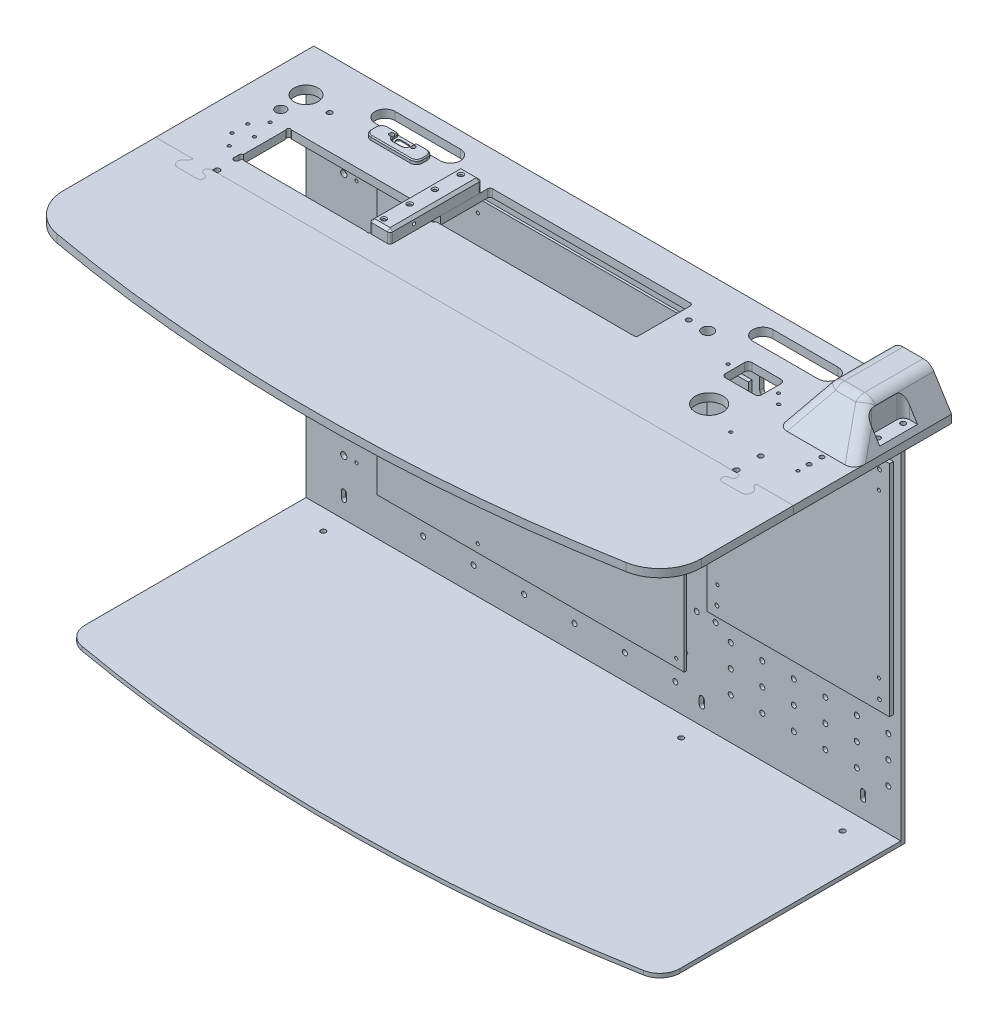
from build123d import *

# Parameters (mm, degrees)
BOSS_EXTRUDE1_DEPTH  = 6.35
SKETCH2_W            = 472
SKETCH2_H            = 287
BOSS_EXTRUDE2_DEPTH  = 3.2
CUT_EXTRUDE1_DEPTH   = 446.276139042
SKETCH4_W            = 243.84
SKETCH4_H            = 243.84
SKETCH4_R            = 1.25
BOSS_EXTRUDE3_DEPTH  = 1.9
SKETCH6_R            = 1.25
CUT_EXTRUDE3_DEPTH   = 446.276139042
SKETCH34_W           = 28
SKETCH34_H           = 87
CUT_EXTRUDE27_DEPTH  = 446.276139042
FILLET4_R            = 3
CUT_EXTRUDE2_DEPTH   = 403.651524274
SKETCH37_R           = 1.5
BOSS_EXTRUDE10_DEPTH = 3
CUT_EXTRUDE18_DEPTH  = 403.651524274
SKETCH36_W           = 41
SKETCH36_H           = 13.5
SKETCH36_R           = 1.75
BOSS_EXTRUDE9_DEPTH  = 3
CUT_EXTRUDE31_DEPTH  = 2.2
FILLET5_R            = 5
FILLET7_R            = 2
CHAMFER6_SIZE        = 0.8
SKETCH7_R            = 2
CUT_EXTRUDE4_DEPTH   = 403.651524274
SKETCH8_R            = 2
CUT_EXTRUDE5_DEPTH   = 446.276139042
SKETCH9_R            = 5.45
SKETCH9_R_2          = 9.525
SKETCH9_R_3          = 4
SKETCH9_R_4          = 4.5
CUT_EXTRUDE6_DEPTH   = 403.651524274
SKETCH10_R           = 1.25
SKETCH10_W           = 29
SKETCH10_H           = 21
CUT_EXTRUDE7_DEPTH   = 403.651524274
FILLET1_R            = 3
SKETCH11_R           = 11
CUT_EXTRUDE8_DEPTH   = 403.651524274
SKETCH13_R           = 1.25
CUT_EXTRUDE9_DEPTH   = 403.651524274
SKETCH14_R           = 1.5
CUT_EXTRUDE10_DEPTH  = 403.651524274
CUT_EXTRUDE15_DEPTH  = 403.651524274
SKETCH39_R           = 1.25
CUT_EXTRUDE29_DEPTH  = 408.202004538
SKETCH15_R           = 2
CUT_EXTRUDE11_DEPTH  = 446.276139042
SKETCH16_R           = 2
CUT_EXTRUDE12_DEPTH  = 403.651524274
SKETCH17_R           = 2
BOSS_EXTRUDE5_DEPTH  = 3.2
SKETCH18_R           = 1.25
SKETCH18_R_2         = 1.75
CUT_EXTRUDE13_DEPTH  = 403.651524274
BOSS_EXTRUDE6_DEPTH  = 6.35
CUT_EXTRUDE14_START  = -1
CUT_EXTRUDE14_DEPTH  = 8
SKETCH22_R           = 2.5
SKETCH22_R_2         = 1.25
CUT_EXTRUDE16_DEPTH  = 446.276139042
SKETCH26_W           = 60.9
SKETCH26_H           = 77.05
BOSS_EXTRUDE8_DEPTH  = 27
SKETCH27_W           = 21
SKETCH27_H           = 22
CUT_EXTRUDE20_DEPTH  = 25
CUT_EXTRUDE21_DEPTH  = 445.027727175
CUT_EXTRUDE23_DEPTH  = 596.109443716
CUT_EXTRUDE22_DEPTH  = 458.579501289
SKETCH31_R           = 5
SKETCH31_R_2         = 2
CUT_EXTRUDE24_DEPTH  = 408.202004538
CUT_EXTRUDE25_DEPTH  = 411.093004695
CHAMFER7_SIZE        = 2
FILLET8_R            = 10
SKETCH33_R           = 1.25
CUT_EXTRUDE26_DEPTH  = 408.2020046
CHAMFER2_SIZE        = 12
SKETCH38_R           = 1.25
CUT_EXTRUDE28_DEPTH  = 441.739651099
SKETCH40_W           = 16.42
SKETCH40_H           = 72.5
SKETCH40_R           = 1.35
BOSS_EXTRUDE11_DEPTH = 10
SKETCH42_R           = 1.25
CUT_EXTRUDE30_DEPTH  = 474.753761432
FILLET6_R            = 2
CHAMFER3_SIZE        = 2
CHAMFER4_SIZE        = 0.8
CHAMFER5_SIZE        = 1


with BuildPart() as part:
    # Sketch1 → Boss-Extrude1 (new body)
    with BuildSketch(Plane(origin=(0, 0, 0), x_dir=(1, 0, 0), z_dir=(0, 1, 0))):
        with BuildLine():
            Line((-253, 125.5), (253, 125.5))
            Line((253, 125.5), (253, -73.008828273))
            ThreePointArc((253, -73.008828273), (245.302764436, -94.193023133), (225.801811401, -105.494809626))
            ThreePointArc((225.801811401, -105.494809626), (0, -125.5), (-225.801811401, -105.494809626))
            ThreePointArc((-225.801811401, -105.494809626), (-245.302764436, -94.193023133), (-253, -73.008828273))
            Line((-253, -73.008828273), (-253, 125.5))
        make_face()
        with BuildLine():
            Line((175.75, 96.8), (124, 96.8))
            ThreePointArc((124, 96.8), (116, 104.8), (124, 112.8))
            Line((124, 112.8), (175.75, 112.8))
            ThreePointArc((175.75, 112.8), (183.75, 104.8), (175.75, 96.8))
        make_face(mode=Mode.SUBTRACT)
        with BuildLine():
            Line((-175.75, 112.8), (-124, 112.8))
            ThreePointArc((-124, 112.8), (-116, 104.8), (-124, 96.8))
            Line((-124, 96.8), (-175.75, 96.8))
            ThreePointArc((-175.75, 96.8), (-183.75, 104.8), (-175.75, 112.8))
        make_face(mode=Mode.SUBTRACT)
    extrude(amount=BOSS_EXTRUDE1_DEPTH)

    # Sketch5 → Cut-Extrude2 (cut, through all)
    with BuildSketch(Plane.XZ):
        with BuildLine():
            Line((75, -55.3), (75, -96.3))
            ThreePointArc((75, -96.3), (74.414213562, -97.714213562), (73, -98.3))
            Line((73, -98.3), (-84, -98.3))
            ThreePointArc((-84, -98.3), (-85.414213562, -97.714213562), (-86, -96.3))
            Line((-86, -96.3), (-86, -55.3))
            ThreePointArc((-86, -55.3), (-85.414213562, -53.885786438), (-84, -53.3))
            Line((-84, -53.3), (73, -53.3))
            ThreePointArc((73, -53.3), (74.414213562, -53.885786438), (75, -55.3))
        make_face()
    extrude(amount=-CUT_EXTRUDE2_DEPTH, mode=Mode.SUBTRACT)

    # USB-C-sketch → Cut-Extrude18 (cut, through all)
    with BuildSketch(Plane.XZ):
        with BuildLine():
            Line((-162.375, -96.8), (-137.375, -96.8))
            Line((-137.375, -96.8), (-137.375, -92.55))
            ThreePointArc((-137.375, -92.55), (-138.61979618, -89.54479618), (-141.625, -88.3))
            Line((-141.625, -88.3), (-158.125, -88.3))
            ThreePointArc((-158.125, -88.3), (-161.13020382, -89.54479618), (-162.375, -92.55))
            Line((-162.375, -92.55), (-162.375, -96.8))
        make_face()
    extrude(amount=-CUT_EXTRUDE18_DEPTH, mode=Mode.SUBTRACT)

    # Sketch7 → Cut-Extrude4 (cut, through all)
    with BuildSketch(Plane.XZ):
        with Locations(Location((84, -86, 0), (0, 0, 270))):
            Circle(SKETCH7_R)
        with Locations(Location((-201, -86, 0), (0, 0, 270))):
            Circle(SKETCH7_R)
        with Locations(Location((201, -86, 0), (0, 0, 270))):
            Circle(SKETCH7_R)
        with Locations(Location((-107, -86, 0), (0, 0, 270))):
            Circle(SKETCH7_R)
    extrude(amount=-CUT_EXTRUDE4_DEPTH, mode=Mode.SUBTRACT)

    # Sketch9 → Cut-Extrude6 (cut, through all)
    with BuildSketch(Plane.XZ):
        with Locations(Location((222.55, -88.85, 0), (0, 0, 270))):
            Circle(SKETCH9_R)
        with Locations(Location((-222.55, -88.85, 0), (0, 0, 270))):
            Circle(SKETCH9_R_2)
        with Locations(Location((-222.55, -68.85, 0), (0, 0, 270))):
            Circle(SKETCH9_R_3)
        with Locations(Location((99, -86, 0), (0, 0, 270))):
            Circle(SKETCH9_R_4)
    extrude(amount=-CUT_EXTRUDE6_DEPTH, mode=Mode.SUBTRACT)

    # Sketch10 → Cut-Extrude7 (cut, through all)
    with BuildSketch(Plane.XZ):
        with Locations(Location((129.875, -71.3, 0), (0, 0, 270))):
            Circle(SKETCH10_R)
        with Locations(Location((169.875, -71.3, 0), (0, 0, 270))):
            Circle(SKETCH10_R)
        with Locations((149.875, -71.3)):
            Rectangle(SKETCH10_W, SKETCH10_H)
    extrude(amount=-CUT_EXTRUDE7_DEPTH, mode=Mode.SUBTRACT)

    # Fillet1
    fillet1_edges = [part.edges().sort_by_distance(p)[0] for p in [
        (164.375, 3.175, -60.8),
        (164.375, 3.175, -81.8),
        (135.375, 3.175, -81.8),
        (135.375, 3.175, -60.8),
    ]]
    fillet(fillet1_edges, radius=FILLET1_R)

    # Sketch11 → Cut-Extrude8 (cut, through all)
    with BuildSketch(Plane.XZ):
        with Locations(Location((149.875, -36.3, 0), (0, 0, 270))):
            Circle(SKETCH11_R)
    extrude(amount=-CUT_EXTRUDE8_DEPTH, mode=Mode.SUBTRACT)

    # Sketch13 → Cut-Extrude9 (cut, through all)
    with BuildSketch(Plane.XZ):
        with Locations(Location((-214.183553391, -39.5, 0), (0, 0, 270))):
            Circle(SKETCH13_R)
        with Locations(Location((-217.933553391, -55.75, 0), (0, 0, 270))):
            Circle(SKETCH13_R)
        with Locations(Location((-225.67, -45.75, 0), (0, 0, 270))):
            Circle(SKETCH13_R)
        with Locations(Location((-225.67, -33.25, 0), (0, 0, 270))):
            Circle(SKETCH13_R)
        with Locations(Location((-217.933553391, -23.25, 0), (0, 0, 270))):
            Circle(SKETCH13_R)
        with Locations(Location((-96.42, -24.5, 0), (0, 0, 270))):
            Circle(SKETCH13_R)
        Polygon((-206.42, -59), (-103.42, -59), (-102.42, -59), (-102.42, -19), (-206.42, -19), (-206.42, -20), align=None)
    extrude(amount=-CUT_EXTRUDE9_DEPTH, mode=Mode.SUBTRACT)

    # Sketch14 → Cut-Extrude10 (cut, through all)
    with BuildSketch(Plane.XZ):
        with Locations((-205.359339828, -20.060660172)):
            Circle(SKETCH14_R)
        with Locations((-205.359339828, -57.939339828)):
            Circle(SKETCH14_R)
        with Locations((-103.480660172, -20.060660172)):
            Circle(SKETCH14_R)
        with BuildLine():
            Line((-102.42, -59), (-102.42, -64))
            ThreePointArc((-102.42, -64), (-104.92, -66.5), (-107.42, -64))
            Line((-107.42, -64), (-107.42, -59))
            Line((-107.42, -59), (-102.42, -59))
        make_face()
    extrude(amount=-CUT_EXTRUDE10_DEPTH, mode=Mode.SUBTRACT)

    # Sketch20 → Cut-Extrude15 (cut, through all)
    with BuildSketch(Plane.XZ):
        with BuildLine():
            Line((-102.42, -51), (-87.42, -51))
            ThreePointArc((-87.42, -51), (-84.591572875, -52.171572875), (-83.42, -55))
            Line((-83.42, -55), (-83.42, -59))
            Line((-83.42, -59), (-87.42, -59))
            Line((-87.42, -59), (-102.42, -59))
            Line((-102.42, -59), (-102.42, -51))
        make_face()
    extrude(amount=-CUT_EXTRUDE15_DEPTH, mode=Mode.SUBTRACT)

    # Sketch39 → Cut-Extrude29 (cut, through all)
    with BuildSketch(Plane(origin=(0, 6.35, 0), x_dir=(1, 0, 0), z_dir=(0, 1, 0))):
        with Locations(Location((-96.42, 45, 0), (0, 0, 270))):
            Circle(SKETCH39_R)
        with Locations(Location((-96.42, 65, 0), (0, 0, 270))):
            Circle(SKETCH39_R)
        with Locations(Location((-96.42, 85.5, 0), (0, 0, 270))):
            Circle(SKETCH39_R)
    extrude(amount=-CUT_EXTRUDE29_DEPTH, mode=Mode.SUBTRACT)

    # Sketch16 → Cut-Extrude12 (cut, through all)
    with BuildSketch(Plane.XZ):
        with Locations(Location((206, -21, 0), (0, 0, 270))):
            Circle(SKETCH16_R)
        with BuildLine():
            Line((-208, -2), (-208, 0))
            Line((-208, 0), (-204, 0))
            Line((-204, 0), (-204, -2))
            ThreePointArc((-204, -2), (-206, -4), (-208, -2))
        make_face()
        with BuildLine():
            Line((204, -2), (204, 0))
            Line((204, 0), (208, 0))
            Line((208, 0), (208, -2))
            ThreePointArc((208, -2), (206, -4), (204, -2))
        make_face()
        with BuildLine():
            Line((-208, -21), (-208, -17))
            ThreePointArc((-208, -17), (-206, -15), (-204, -17))
            Line((-204, -17), (-204, -21))
            ThreePointArc((-204, -21), (-206, -23), (-208, -21))
        make_face()
    extrude(amount=-CUT_EXTRUDE12_DEPTH, mode=Mode.SUBTRACT)


with BuildPart() as body_2:
    # Sketch2 → Boss-Extrude2 (new body)
    with BuildSketch(Plane(origin=(0, 0, -105.5), x_dir=(-1, 0, 0), z_dir=(0, 0, -1))):
        with Locations((0, -143.5)):
            Rectangle(SKETCH2_W, SKETCH2_H)
    extrude(amount=-BOSS_EXTRUDE2_DEPTH)

    # Sketch3 → Cut-Extrude1 (cut, through all)
    with BuildSketch(Plane.XY.offset(-102.3)):
        with BuildLine():
            Line((-172.75, -33), (-127, -33))
            ThreePointArc((-127, -33), (-124.878679656, -32.121320344), (-124, -30))
            Line((-124, -30), (-124, 0))
            Line((-124, 0), (-175.75, 0))
            Line((-175.75, 0), (-175.75, -30))
            ThreePointArc((-175.75, -30), (-174.871320344, -32.121320344), (-172.75, -33))
        make_face()
        with BuildLine():
            Line((124, -30), (124, 0))
            Line((124, 0), (175.75, 0))
            Line((175.75, 0), (175.75, -30))
            ThreePointArc((175.75, -30), (174.871320344, -32.121320344), (172.75, -33))
            Line((172.75, -33), (127, -33))
            ThreePointArc((127, -33), (124.878679656, -32.121320344), (124, -30))
        make_face()
    extrude(amount=-CUT_EXTRUDE1_DEPTH, mode=Mode.SUBTRACT)

    # Sketch6 → Cut-Extrude3 (cut, through all)
    with BuildSketch(Plane.XY.offset(-102.3)):
        with Locations(Location((-91.83, -239.49, 0), (0, 0, 180))):
            Circle(SKETCH6_R)
        with Locations(Location((-91.83, -167.1, 0), (0, 0, 180))):
            Circle(SKETCH6_R)
        with Locations(Location((-137.55, -167.1, 0), (0, 0, 180))):
            Circle(SKETCH6_R)
        with Locations(Location((-157.87, -167.1, 0), (0, 0, 180))):
            Circle(SKETCH6_R)
        with Locations(Location((65.65, -167.1, 0), (0, 0, 180))):
            Circle(SKETCH6_R)
        with Locations(Location((65.65, -239.49, 0), (0, 0, 180))):
            Circle(SKETCH6_R)
        with Locations(Location((65.65, -35.02, 0), (0, 0, 180))):
            Circle(SKETCH6_R)
        with Locations(Location((-137.55, -12.16, 0), (0, 0, 180))):
            Circle(SKETCH6_R)
        with Locations(Location((-91.83, -12.16, 0), (0, 0, 180))):
            Circle(SKETCH6_R)
        with Locations((99, -28)):
            Circle(SKETCH6_R)
        with Locations((228, -28)):
            Circle(SKETCH6_R)
        with Locations((228, -186)):
            Circle(SKETCH6_R)
        with Locations((99, -186)):
            Circle(SKETCH6_R)
    extrude(amount=-CUT_EXTRUDE3_DEPTH, mode=Mode.SUBTRACT)

    # Sketch34 → Cut-Extrude27 (cut, through all)
    with BuildSketch(Plane.XY.offset(-102.3)):
        with Locations((-65, -85.5)):
            Rectangle(SKETCH34_W, SKETCH34_H)
    extrude(amount=-CUT_EXTRUDE27_DEPTH, mode=Mode.SUBTRACT)

    # Fillet4
    fillet4_edges = [body_2.edges().sort_by_distance(p)[0] for p in [
        (-51, -42, -103.9),
        (-51, -129, -103.9),
        (-79, -129, -103.9),
        (-79, -42, -103.9),
    ]]
    fillet(fillet4_edges, radius=FILLET4_R)

    # Sketch8 → Cut-Extrude5 (cut, through all)
    with BuildSketch(Plane.XY.offset(-102.3)):
        with Locations((-201, -16.3)):
            Circle(SKETCH8_R)
        with Locations((84, -16.3)):
            Circle(SKETCH8_R)
        with Locations((201, -16.3)):
            Circle(SKETCH8_R)
        with Locations((-107, -16.3)):
            Circle(SKETCH8_R)
        with BuildLine():
            Line((-204, -265), (-204, -270))
            ThreePointArc((-204, -270), (-206, -272), (-208, -270))
            Line((-208, -270), (-208, -265))
            ThreePointArc((-208, -265), (-206, -263), (-204, -265))
        make_face()
        with BuildLine():
            Line((76, -270), (76, -265))
            ThreePointArc((76, -265), (78, -263), (80, -265))
            Line((80, -265), (80, -270))
            ThreePointArc((80, -270), (78, -272), (76, -270))
        make_face()
        with BuildLine():
            Line((204, -265), (204, -270))
            ThreePointArc((204, -270), (206, -272), (208, -270))
            Line((208, -270), (208, -265))
            ThreePointArc((208, -265), (206, -263), (204, -265))
        make_face()
    extrude(amount=-CUT_EXTRUDE5_DEPTH, mode=Mode.SUBTRACT)

    # Sketch15 → Cut-Extrude11 (cut, through all)
    with BuildSketch(Plane.XY.offset(-102.3)):
        with Locations((101, -197)):
            Circle(SKETCH15_R)
        with Locations((74, -85.02)):
            Circle(SKETCH15_R)
        with Locations((89, -85.02)):
            Circle(SKETCH15_R)
        with Locations((74, -167.1)):
            Circle(SKETCH15_R)
        with Locations((89, -167.1)):
            Circle(SKETCH15_R)
        with Locations((57, -248.84)):
            Circle(SKETCH15_R)
        with Locations((57, -263.84)):
            Circle(SKETCH15_R)
        with Locations((17, -248.84)):
            Circle(SKETCH15_R)
        with Locations((17, -263.84)):
            Circle(SKETCH15_R)
        with Locations((-23, -248.84)):
            Circle(SKETCH15_R)
        with Locations((-23, -263.84)):
            Circle(SKETCH15_R)
        with Locations((-63, -248.84)):
            Circle(SKETCH15_R)
        with Locations((-63, -263.84)):
            Circle(SKETCH15_R)
        with Locations((-103, -248.84)):
            Circle(SKETCH15_R)
        with Locations((-103, -263.84)):
            Circle(SKETCH15_R)
        with Locations((74, -207.1)):
            Circle(SKETCH15_R)
        with Locations((89, -207.1)):
            Circle(SKETCH15_R)
        with Locations((126, -197)):
            Circle(SKETCH15_R)
        with Locations((151, -197)):
            Circle(SKETCH15_R)
        with Locations((176, -197)):
            Circle(SKETCH15_R)
        with Locations((201, -197)):
            Circle(SKETCH15_R)
        with Locations((226, -197)):
            Circle(SKETCH15_R)
        with Locations((126, -215)):
            Circle(SKETCH15_R)
        with Locations((151, -215)):
            Circle(SKETCH15_R)
        with Locations((176, -215)):
            Circle(SKETCH15_R)
        with Locations((201, -215)):
            Circle(SKETCH15_R)
        with Locations((226, -215)):
            Circle(SKETCH15_R)
        with Locations((126, -233)):
            Circle(SKETCH15_R)
        with Locations((151, -233)):
            Circle(SKETCH15_R)
        with Locations((176, -233)):
            Circle(SKETCH15_R)
        with Locations((201, -233)):
            Circle(SKETCH15_R)
        with Locations((226, -233)):
            Circle(SKETCH15_R)
        with Locations((126, -251)):
            Circle(SKETCH15_R)
        with Locations((151, -251)):
            Circle(SKETCH15_R)
        with Locations((176, -251)):
            Circle(SKETCH15_R)
        with Locations((201, -251)):
            Circle(SKETCH15_R)
        with Locations((226, -251)):
            Circle(SKETCH15_R)
        with Locations((101, -215)):
            Circle(SKETCH15_R)
        with Locations((101, -233)):
            Circle(SKETCH15_R)
        with Locations((101, -251)):
            Circle(SKETCH15_R)
        with Locations((-103, -167.1)):
            Circle(SKETCH15_R)
        with Locations((-116.5, -167.1)):
            Circle(SKETCH15_R)
        with Locations((-103, -127.1)):
            Circle(SKETCH15_R)
        with Locations((-116.5, -127.1)):
            Circle(SKETCH15_R)
        with Locations((-103, -87.1)):
            Circle(SKETCH15_R)
        with Locations((-116.5, -87.1)):
            Circle(SKETCH15_R)
        with Locations((-103, -47.1)):
            Circle(SKETCH15_R)
        with Locations((-116.5, -47.1)):
            Circle(SKETCH15_R)
        with Locations((-143, -248.84)):
            Circle(SKETCH15_R)
        with Locations((-143, -263.84)):
            Circle(SKETCH15_R)
        with Locations((-130, -47.1)):
            Circle(SKETCH15_R)
        with Locations((-143.5, -47.1)):
            Circle(SKETCH15_R)
        with Locations((-143.5, -87.1)):
            Circle(SKETCH15_R)
        with Locations((-143.5, -127.1)):
            Circle(SKETCH15_R)
        with Locations((-130, -87.1)):
            Circle(SKETCH15_R)
        with Locations((-130, -127.1)):
            Circle(SKETCH15_R)
        with Locations((74, -28)):
            Circle(SKETCH15_R)
        with Locations((89, -28)):
            Circle(SKETCH15_R)
        with Locations((74, -126.06)):
            Circle(SKETCH15_R)
        with Locations((89, -126.06)):
            Circle(SKETCH15_R)
        with Locations((-157, -47.1)):
            Circle(SKETCH15_R)
        with Locations((-157, -87.1)):
            Circle(SKETCH15_R)
        with Locations((-157, -127.1)):
            Circle(SKETCH15_R)
    extrude(amount=-CUT_EXTRUDE11_DEPTH, mode=Mode.SUBTRACT)

    # Sketch22 → Cut-Extrude16 (cut, through all)
    with BuildSketch(Plane.XY.offset(-102.3)):
        with Locations((-206, -240)):
            Circle(SKETCH22_R)
        with Locations((-206, -201.26)):
            Circle(SKETCH22_R)
        with Locations((-206, -162.52)):
            Circle(SKETCH22_R)
        with Locations((-206, -123.78)):
            Circle(SKETCH22_R)
        with Locations((-206, -85.04)):
            Circle(SKETCH22_R)
        with Locations((-206, -46.3)):
            Circle(SKETCH22_R)
        with Locations((-196, -240)):
            Circle(SKETCH22_R_2)
        with Locations((-196, -201.26)):
            Circle(SKETCH22_R_2)
        with Locations((-196, -162.52)):
            Circle(SKETCH22_R_2)
        with Locations((-196, -123.78)):
            Circle(SKETCH22_R_2)
        with Locations((-196, -85.04)):
            Circle(SKETCH22_R_2)
        with Locations((-196, -46.3)):
            Circle(SKETCH22_R_2)
    extrude(amount=-CUT_EXTRUDE16_DEPTH, mode=Mode.SUBTRACT)

    # Chamfer2
    chamfer2_edges = [body_2.edges().sort_by_distance(p)[0] for p in [
        (-124, 0, -103.9),
        (-175.75, 0, -103.9),
        (124, 0, -103.9),
        (175.75, 0, -103.9),
    ]]
    chamfer(chamfer2_edges, length=CHAMFER2_SIZE)


with BuildPart() as body_3:
    # Sketch4 → Boss-Extrude3 (new body)
    with BuildSketch(Plane.XY.offset(-96.3)):
        with Locations((-49.92, -123.92)):
            Rectangle(SKETCH4_W, SKETCH4_H)
        with Locations(Location((-137.55, -12.16, 0), (0, 0, 180))):
            Circle(SKETCH4_R, mode=Mode.SUBTRACT)
        with Locations(Location((-91.83, -12.16, 0), (0, 0, 180))):
            Circle(SKETCH4_R, mode=Mode.SUBTRACT)
        with Locations(Location((-137.55, -167.1, 0), (0, 0, 180))):
            Circle(SKETCH4_R, mode=Mode.SUBTRACT)
        with Locations(Location((-91.83, -167.1, 0), (0, 0, 180))):
            Circle(SKETCH4_R, mode=Mode.SUBTRACT)
        with Locations(Location((-157.87, -167.1, 0), (0, 0, 180))):
            Circle(SKETCH4_R, mode=Mode.SUBTRACT)
        with Locations(Location((65.65, -35.02, 0), (0, 0, 180))):
            Circle(SKETCH4_R, mode=Mode.SUBTRACT)
        with Locations(Location((-91.83, -239.49, 0), (0, 0, 180))):
            Circle(SKETCH4_R, mode=Mode.SUBTRACT)
        with Locations(Location((65.65, -167.1, 0), (0, 0, 180))):
            Circle(SKETCH4_R, mode=Mode.SUBTRACT)
        with Locations(Location((65.65, -239.49, 0), (0, 0, 180))):
            Circle(SKETCH4_R, mode=Mode.SUBTRACT)
    extrude(amount=BOSS_EXTRUDE3_DEPTH)


with BuildPart() as body_4:
    # Sketch37 → Boss-Extrude10 (new body)
    with BuildSketch(Plane.XY.offset(-96.3)):
        with BuildLine():
            Line((91, -194), (236, -194))
            Line((236, -194), (236, -20))
            Line((236, -20), (218, -20))
            Line((218, -20), (218, -30))
            ThreePointArc((218, -30), (217.121320344, -32.121320344), (215, -33))
            Line((215, -33), (172.75, -33))
            Line((172.75, -33), (127, -33))
            ThreePointArc((127, -33), (124.878679656, -32.121320344), (124, -30))
            Line((124, -30), (124, -20))
            Line((124, -20), (91, -20))
            Line((91, -20), (91, -194))
        make_face()
        with Locations((99, -28)):
            Circle(SKETCH37_R, mode=Mode.SUBTRACT)
        with Locations((228, -28)):
            Circle(SKETCH37_R, mode=Mode.SUBTRACT)
        with Locations((228, -186)):
            Circle(SKETCH37_R, mode=Mode.SUBTRACT)
        with Locations((99, -186)):
            Circle(SKETCH37_R, mode=Mode.SUBTRACT)
    extrude(amount=BOSS_EXTRUDE10_DEPTH)


with BuildPart() as body_5:
    # Sketch36 → Boss-Extrude9 (new body)
    with BuildSketch(Plane(origin=(0, 6.35, 0), x_dir=(1, 0, 0), z_dir=(0, 1, 0))):
        with Locations((-149.875, 90.05)):
            Rectangle(SKETCH36_W, SKETCH36_H)
        with Locations(Location((-158.375, 92.55, 0), (0, 0, 270))):
            Circle(SKETCH36_R, mode=Mode.SUBTRACT)
        with Locations(Location((-141.375, 92.55, 0), (0, 0, 270))):
            Circle(SKETCH36_R, mode=Mode.SUBTRACT)
        with BuildLine():
            Line((-152.875, 94.55), (-146.875, 94.55))
            ThreePointArc((-146.875, 94.55), (-144.875, 92.55), (-146.875, 90.55))
            Line((-146.875, 90.55), (-152.875, 90.55))
            ThreePointArc((-152.875, 90.55), (-154.875, 92.55), (-152.875, 94.55))
        make_face(mode=Mode.SUBTRACT)
    extrude(amount=BOSS_EXTRUDE9_DEPTH)

    # Sketch44 → Cut-Extrude31 (cut)
    with BuildSketch(Plane(origin=(0, 9.35, 0), x_dir=(1, 0, 0), z_dir=(0, 1, 0))):
        with BuildLine():
            Line((-156.525, 92.55), (-156.525, 96.8))
            Line((-156.525, 96.8), (-143.225, 96.8))
            Line((-143.225, 96.8), (-143.225, 92.55))
            ThreePointArc((-143.225, 92.55), (-144.294060249, 89.969060249), (-146.875, 88.9))
            Line((-146.875, 88.9), (-152.875, 88.9))
            ThreePointArc((-152.875, 88.9), (-155.455939751, 89.969060249), (-156.525, 92.55))
        make_face()
    extrude(amount=-CUT_EXTRUDE31_DEPTH, mode=Mode.SUBTRACT)

    # Fillet5
    fillet5_edges = [body_5.edges().sort_by_distance(p)[0] for p in [
        (-129.375, 7.85, -83.3),
        (-170.375, 7.85, -83.3),
        (-170.375, 7.85, -96.8),
        (-129.375, 7.85, -96.8),
    ]]
    fillet(fillet5_edges, radius=FILLET5_R)

    # Fillet7
    fillet7_edges = [body_5.edges().sort_by_distance(p)[0] for p in [
        (-156.525, 8.25, -96.8),
        (-143.225, 8.25, -96.8),
    ]]
    fillet(fillet7_edges, radius=FILLET7_R)

    # Chamfer6
    # the kernel refuses this chamfer: 0.8 mm, written as the material it takes off along each edge
    with BuildSketch(Plane(origin=(-152.875, 9.35, -92.55), x_dir=(0, 0, 1), z_dir=(1, 0, 0))) as chamfer6_piece_1:
        Polygon((3.65, CHAMFER6_SIZE), (3.65 + CHAMFER6_SIZE, 0), (3.65, 0), align=None)
    revolve(axis=Axis((-152.875, 9.35, -92.55), (0, -1, 0)), revolution_arc=90, mode=Mode.SUBTRACT)
    with BuildSketch(Plane(origin=(-146.875, 9.35, -88.9), x_dir=(0, -1, 0), z_dir=(-1, 0, 0))) as chamfer6_piece_2:
        Polygon((CHAMFER6_SIZE, 0), (0, CHAMFER6_SIZE), (0, 0), align=None)
    extrude(amount=6, mode=Mode.SUBTRACT)
    with BuildSketch(Plane(origin=(-146.875, 9.35, -92.55), x_dir=(1, 0, 0), z_dir=(0, 0, -1))) as chamfer6_piece_3:
        Polygon((3.65, CHAMFER6_SIZE), (3.65 + CHAMFER6_SIZE, 0), (3.65, 0), align=None)
    revolve(axis=Axis((-146.875, 9.35, -92.55), (0, -1, 0)), revolution_arc=90, mode=Mode.SUBTRACT)
    with BuildSketch(Plane(origin=(-143.225, 9.35, -94.8), x_dir=(0, -1, 0), z_dir=(0, 0, 1)), Plane(origin=(-156.525, 9.35, -92.55), x_dir=(0, -1, 0), z_dir=(0, 0, -1))) as chamfer6_piece_4:
        Polygon((CHAMFER6_SIZE, 0), (0, CHAMFER6_SIZE), (0, 0), align=None)
    extrude(amount=2.25, mode=Mode.SUBTRACT)
    with BuildSketch(Plane(origin=(-170.375, 9.35, -88.3), x_dir=(0, -1, 0), z_dir=(0, 0, -1)), Plane(origin=(-129.375, 9.35, -91.8), x_dir=(0, -1, 0), z_dir=(0, 0, 1))) as chamfer6_piece_5:
        Polygon((CHAMFER6_SIZE, 0), (0, -CHAMFER6_SIZE), (0, 0), align=None)
    extrude(amount=3.5, mode=Mode.SUBTRACT)
    with BuildSketch(Plane(origin=(-141.225, 9.35, -96.8), x_dir=(0, -1, 0), z_dir=(1, 0, 0)), Plane(origin=(-165.375, 9.35, -96.8), x_dir=(0, -1, 0), z_dir=(1, 0, 0))) as chamfer6_piece_6:
        Polygon((CHAMFER6_SIZE, 0), (0, -CHAMFER6_SIZE), (0, 0), align=None)
    extrude(amount=6.85, mode=Mode.SUBTRACT)
    with BuildSketch(Plane(origin=(-134.375, 9.35, -83.3), x_dir=(0, -1, 0), z_dir=(-1, 0, 0))) as chamfer6_piece_7:
        Polygon((CHAMFER6_SIZE, 0), (0, -CHAMFER6_SIZE), (0, 0), align=None)
    extrude(amount=31, mode=Mode.SUBTRACT)
    with BuildSketch(Plane(origin=(-165.375, 9.35, -88.3), x_dir=(-1, 0, 0), z_dir=(0, 0, -1))) as chamfer6_piece_8:
        Polygon((5, -CHAMFER6_SIZE), (5 - CHAMFER6_SIZE, 0), (5, 0), align=None)
    revolve(axis=Axis((-165.375, 9.35, -88.3), (0, 1, 0)), revolution_arc=90, mode=Mode.SUBTRACT)
    with BuildSketch(Plane(origin=(-134.375, 9.35, -88.3), x_dir=(1, 0, 0), z_dir=(0, 0, -1))) as chamfer6_piece_9:
        Polygon((5, CHAMFER6_SIZE), (5 - CHAMFER6_SIZE, 0), (5, 0), align=None)
    revolve(axis=Axis((-134.375, 9.35, -88.3), (0, -1, 0)), revolution_arc=90, mode=Mode.SUBTRACT)
    with BuildSketch(Plane(origin=(-134.375, 9.35, -91.8), x_dir=(0, 0, -1), z_dir=(-1, 0, 0))) as chamfer6_piece_10:
        Polygon((5, CHAMFER6_SIZE), (5 - CHAMFER6_SIZE, 0), (5, 0), align=None)
    revolve(axis=Axis((-134.375, 9.35, -91.8), (0, -1, 0)), revolution_arc=90, mode=Mode.SUBTRACT)
    with BuildSketch(Plane(origin=(-165.375, 9.35, -91.8), x_dir=(0, 0, -1), z_dir=(1, 0, 0))) as chamfer6_piece_11:
        Polygon((5, -CHAMFER6_SIZE), (5 - CHAMFER6_SIZE, 0), (5, 0), align=None)
    revolve(axis=Axis((-165.375, 9.35, -91.8), (0, 1, 0)), revolution_arc=90, mode=Mode.SUBTRACT)
    with BuildSketch(Plane(origin=(-158.525, 9.35, -94.8), x_dir=(0, 0, -1), z_dir=(-1, 0, 0))) as chamfer6_piece_12:
        Polygon((2, CHAMFER6_SIZE), (2 - CHAMFER6_SIZE, 0), (2, 0), align=None)
    revolve(axis=Axis((-158.525, 9.35, -94.8), (0, -1, 0)), revolution_arc=90, mode=Mode.SUBTRACT)
    with BuildSketch(Plane(origin=(-141.225, 9.35, -94.8), x_dir=(0, 0, -1), z_dir=(1, 0, 0))) as chamfer6_piece_13:
        Polygon((2, -CHAMFER6_SIZE), (2 - CHAMFER6_SIZE, 0), (2, 0), align=None)
    revolve(axis=Axis((-141.225, 9.35, -94.8), (0, 1, 0)), revolution_arc=90, mode=Mode.SUBTRACT)


with BuildPart() as body_6:
    # Split1: the piece on the far side of the plane
    add(part.part)
    split(bisect_by=Plane.XY, keep=Keep.BOTTOM)

    # Sketch18 → Cut-Extrude13 (cut, through all)
    with BuildSketch(Plane.XZ):
        with Locations(Location((177.66, -25.59, 0), (0, 0, 270))):
            Circle(SKETCH18_R)
        with Locations(Location((231, -25.59, 0), (0, 0, 270))):
            Circle(SKETCH18_R)
        with Locations(Location((231, -34.48, 0), (0, 0, 270))):
            Circle(SKETCH18_R_2)
        with Locations(Location((231, -44.64, 0), (0, 0, 270))):
            Circle(SKETCH18_R_2)
        with Locations(Location((177.66, -63.69, 0), (0, 0, 270))):
            Circle(SKETCH18_R)
        with Locations(Location((231, -63.69, 0), (0, 0, 270))):
            Circle(SKETCH18_R)
    extrude(amount=-CUT_EXTRUDE13_DEPTH, mode=Mode.SUBTRACT)

    # Sketch19 → Boss-Extrude6 (add)
    with BuildSketch(Plane.XZ):
        with BuildLine():
            Line((-223.49, 12), (-208.49, 12))
            ThreePointArc((-208.49, 12), (-205.49, 9), (-208.49, 6))
            ThreePointArc((-208.49, 6), (-211.49, 3), (-208.49, 0))
            Line((-208.49, 0), (-223.49, 0))
            ThreePointArc((-223.49, 0), (-224.078457268, 2.196152423), (-225.686152423, 3.803847577))
            ThreePointArc((-225.686152423, 3.803847577), (-227.732640687, 8.7445073), (-223.49, 12))
        make_face()
        with BuildLine():
            Line((223.49, 12), (208.49, 12))
            ThreePointArc((208.49, 12), (205.49, 9), (208.49, 6))
            ThreePointArc((208.49, 6), (211.49, 3), (208.49, 0))
            Line((208.49, 0), (223.49, 0))
            ThreePointArc((223.49, 0), (224.078457268, 2.196152423), (225.686152423, 3.803847577))
            ThreePointArc((225.686152423, 3.803847577), (227.732640687, 8.7445073), (223.49, 12))
        make_face()
    extrude(amount=-BOSS_EXTRUDE6_DEPTH)

    # Sketch33 → Cut-Extrude26 (cut, through all)
    with BuildSketch(Plane(origin=(0, 6.35, 0), x_dir=(1, 0, 0), z_dir=(0, 1, 0))):
        with Locations(Location((201, 96, 0), (0, 0, 270))):
            Circle(SKETCH33_R)
        with Locations(Location((244.1, 96, 0), (0, 0, 270))):
            Circle(SKETCH33_R)
        with Locations(Location((201, 76, 0), (0, 0, 270))):
            Circle(SKETCH33_R)
        with Locations(Location((244.1, 76, 0), (0, 0, 270))):
            Circle(SKETCH33_R)
    extrude(amount=-CUT_EXTRUDE26_DEPTH, mode=Mode.SUBTRACT)


with BuildPart() as part_1:
    add(part.part)

    # Split1
    split(bisect_by=Plane.XY, keep=Keep.TOP)

    # Cut-Extrude14: read off the stored shape, not the designer's step
    # Cut-Extrude14 outline → Cut-Extrude14 (cut)
    with BuildSketch(Plane(origin=(0, 0, 0), x_dir=(1, 0, 0), z_dir=(0, 1, 0)).offset(CUT_EXTRUDE14_START)):
        with BuildLine():
            ThreePointArc((223.49, -12), (227.732640687, -8.7445073), (225.686152423, -3.803847577))
            ThreePointArc((225.686152423, -3.803847577), (224.078457268, -2.196152423), (223.49, 0))
            Line((223.49, 0), (208.49, 0))
            ThreePointArc((208.49, 0), (211.49, -3), (208.49, -6))
            ThreePointArc((208.49, -6), (205.49, -9), (208.49, -12))
            Line((208.49, -12), (223.49, -12))
        make_face()
        with BuildLine():
            ThreePointArc((-208.49, -6), (-211.49, -3), (-208.49, 0))
            Line((-208.49, 0), (-223.49, 0))
            ThreePointArc((-223.49, 0), (-224.078457268, -2.196152423), (-225.686152423, -3.803847577))
            ThreePointArc((-225.686152423, -3.803847577), (-227.732640687, -8.7445073), (-223.49, -12))
            Line((-223.49, -12), (-208.49, -12))
            ThreePointArc((-208.49, -12), (-205.49, -9), (-208.49, -6))
        make_face()
    extrude(amount=CUT_EXTRUDE14_DEPTH, mode=Mode.SUBTRACT)


with BuildPart() as body_7:
    # Sketch17 → Boss-Extrude5 (new body)
    with BuildSketch(Plane.XZ.offset(287)):
        with BuildLine():
            Line((236, 73.008828273), (236, -102.3))
            Line((236, -102.3), (-236, -102.3))
            Line((-236, -102.3), (-236, 73.008828273))
            ThreePointArc((-236, 73.008828273), (-232.268006999, 83.279953054), (-222.812999467, 88.759607111))
            ThreePointArc((-222.812999467, 88.759607111), (0, 108.5), (222.812999467, 88.759607111))
            ThreePointArc((222.812999467, 88.759607111), (232.268006999, 83.279953054), (236, 73.008828273))
        make_face()
        with Locations((-206, -86)):
            Circle(SKETCH17_R, mode=Mode.SUBTRACT)
        with Locations((78, -86)):
            Circle(SKETCH17_R, mode=Mode.SUBTRACT)
        with Locations((206, -86)):
            Circle(SKETCH17_R, mode=Mode.SUBTRACT)
    extrude(amount=-BOSS_EXTRUDE5_DEPTH)


with BuildPart() as body_8:
    # Sketch26 → Boss-Extrude8 (new body)
    with BuildSketch(Plane(origin=(0, 6.35, 0), x_dir=(1, 0, 0), z_dir=(0, 1, 0))):
        with Locations((222.55, 86.975)):
            Rectangle(SKETCH26_W, SKETCH26_H)
    extrude(amount=BOSS_EXTRUDE8_DEPTH)

    # Sketch27 → Cut-Extrude20 (cut)
    with BuildSketch(Plane.XZ.offset(-6.35)):
        with Locations((222.55, -88.85)):
            Rectangle(SKETCH27_W, SKETCH27_H)
    extrude(amount=-CUT_EXTRUDE20_DEPTH, mode=Mode.SUBTRACT)

    # Sketch28 → Cut-Extrude21 (cut, through all)
    with BuildSketch(Plane.XY.offset(-99.85)):
        with BuildLine():
            Line((230.3, 22.35), (230.3, 6.35))
            ThreePointArc((230.3, 6.35), (222.55, -1.4), (214.8, 6.35))
            Line((214.8, 6.35), (214.8, 22.35))
            ThreePointArc((214.8, 22.35), (222.55, 30.1), (230.3, 22.35))
        make_face()
    extrude(amount=-CUT_EXTRUDE21_DEPTH, mode=Mode.SUBTRACT)

    # Sketch30 → Cut-Extrude23 (cut, through all)
    with BuildSketch(Plane(origin=(253, 0, 0), x_dir=(0, 0, -1), z_dir=(1, 0, 0))):
        Polygon((48.45, 33.35), (74.85, 33.35), (48.45, 6.35), align=None)
    extrude(amount=-CUT_EXTRUDE23_DEPTH, mode=Mode.SUBTRACT)

    # Sketch29 → Cut-Extrude22 (cut, through all)
    with BuildSketch(Plane.XY.offset(-125.5)):
        Polygon((253, 6.35), (236.05, 33.35), (253, 33.35), align=None)
        Polygon((209.05, 33.35), (192.1, 33.35), (192.1, 6.35), align=None)
    extrude(amount=CUT_EXTRUDE22_DEPTH, mode=Mode.SUBTRACT)

    # Sketch31 → Cut-Extrude24 (cut, through all)
    with BuildSketch(Plane.XZ.offset(-6.35)):
        with Locations(Location((201, -86, 0), (0, 0, 270))):
            Circle(SKETCH31_R)
        with Locations(Location((201, -76, 0), (0, 0, 270))):
            Circle(SKETCH31_R_2)
        with Locations(Location((201, -96, 0), (0, 0, 270))):
            Circle(SKETCH31_R_2)
        with Locations((244.1, -76)):
            Circle(SKETCH31_R_2)
        with Locations((244.1, -96)):
            Circle(SKETCH31_R_2)
    extrude(amount=-CUT_EXTRUDE24_DEPTH, mode=Mode.SUBTRACT)

    # Sketch32 → Cut-Extrude25 (cut, through all)
    with BuildSketch(Plane(origin=(0, 10.35, 0), x_dir=(-1, 0, 0), z_dir=(0, -1, 0))):
        with BuildLine():
            Line((-201, 101), (-192.1, 101))
            Line((-192.1, 101), (-192.1, 71))
            Line((-192.1, 71), (-201, 71))
            ThreePointArc((-201, 71), (-204.535533906, 72.464466094), (-206, 76))
            Line((-206, 76), (-206, 96))
            ThreePointArc((-206, 96), (-204.535533906, 99.535533906), (-201, 101))
        make_face()
        with BuildLine():
            Line((-239.1, 96), (-239.1, 76))
            ThreePointArc((-239.1, 76), (-240.564466094, 72.464466094), (-244.1, 71))
            Line((-244.1, 71), (-253, 71))
            Line((-253, 71), (-253, 101))
            Line((-253, 101), (-244.1, 101))
            ThreePointArc((-244.1, 101), (-240.564466094, 99.535533906), (-239.1, 96))
        make_face()
    extrude(amount=-CUT_EXTRUDE25_DEPTH, mode=Mode.SUBTRACT)

    # Chamfer7
    chamfer7_edges = [body_8.edges().sort_by_distance(p)[0] for p in [
        (212.05, 31.35, -88.85),
        (233.05, 31.35, -88.85),
    ]]
    chamfer(chamfer7_edges, length=CHAMFER7_SIZE)

    # Fillet8
    # the kernel refuses this fillet: 10 mm, written as the material it takes off along each edge
    with BuildSketch(Plane(origin=(214.579444327, 23.35, -79.058105758), x_dir=(-0.23658213832666763, -0.37685650352920647, 0.8955490313615009), z_dir=(-0.3400007791066015, 0.8955497114893627, 0.2870369043489412))) as fillet8_piece_1_section:
        Polygon((-14.612576379, -14.612576379), (14.612576379, -14.612576379), (14.612576379, 14.612576379), (-14.612576379, 14.612576379), align=None)
    fillet8_piece_1 = extrude(amount=14.612576379, mode=Mode.PRIVATE)
    fillet8_piece_1 = split(fillet8_piece_1, bisect_by=Plane(origin=(214.579444327, 23.35, -79.058105758), z_dir=(0, 0, 1)), keep=Keep.TOP, mode=Mode.PRIVATE)
    fillet8_piece_1 = split(fillet8_piece_1, bisect_by=Plane(origin=(214.579444327, 23.35, -79.058105758), z_dir=(-1, 0, 0)), keep=Keep.TOP, mode=Mode.PRIVATE)
    fillet8_piece_1 = split(fillet8_piece_1, bisect_by=Plane(origin=(214.579444327, 23.35, -79.058105758), z_dir=(0.4095036225588607, 0.6523066554034973, -0.6378109519500847)), keep=Keep.TOP, mode=Mode.PRIVATE)
    fillet8_piece_1 = split(fillet8_piece_1, bisect_by=Plane(origin=(206.110051686, 28.666896491, -79.058105758), z_dir=(0.8469392640722039, -0.5316896491119927, 0)), keep=Keep.TOP, mode=Mode.PRIVATE)
    fillet8_piece_1 = split(fillet8_piece_1, bisect_by=Plane(origin=(214.579444327, 33.35, -79.058105758), z_dir=(0, -1, 0)), keep=Keep.TOP, mode=Mode.PRIVATE)
    fillet8_piece_1 = split(fillet8_piece_1, bisect_by=Plane(origin=(214.579444327, 30.341176319, -71.908039068), z_dir=(0, -0.6991176319238778, -0.7150066690130585)), keep=Keep.TOP, mode=Mode.PRIVATE)
    fillet8_piece_1 = fillet8_piece_1 - Plane(origin=(214.579444327, 23.35, -79.058105758), x_dir=(0.3400007791066015, -0.8955497114893627, -0.2870369043489412), z_dir=(-0.23658213832666763, -0.37685650352920647, 0.8955490313615009)) * Sphere(FILLET8_R, mode=Mode.PRIVATE)
    add(fillet8_piece_1, mode=Mode.SUBTRACT)
    with BuildSketch(Plane(origin=(230.520555673, 23.35, -79.058105758), x_dir=(-0.645082598075517, 0, 0.7641128461556846), z_dir=(0.3400007791066015, 0.8955497114893627, 0.2870369043489412))) as fillet8_piece_2_section:
        Polygon((-14.612576379, -14.612576379), (14.612576379, -14.612576379), (14.612576379, 14.612576379), (-14.612576379, 14.612576379), align=None)
    fillet8_piece_2 = extrude(amount=14.612576379, mode=Mode.PRIVATE)
    fillet8_piece_2 = split(fillet8_piece_2, bisect_by=Plane(origin=(230.520555673, 23.35, -79.058105758), z_dir=(1, 0, 0)), keep=Keep.TOP, mode=Mode.PRIVATE)
    fillet8_piece_2 = split(fillet8_piece_2, bisect_by=Plane(origin=(230.520555673, 23.35, -79.058105758), z_dir=(-0.4095036225588607, 0.6523066554034973, -0.6378109519500847)), keep=Keep.TOP, mode=Mode.PRIVATE)
    fillet8_piece_2 = split(fillet8_piece_2, bisect_by=Plane(origin=(230.520555673, 23.35, -79.058105758), z_dir=(0, 0, 1)), keep=Keep.TOP, mode=Mode.PRIVATE)
    fillet8_piece_2 = split(fillet8_piece_2, bisect_by=Plane(origin=(230.520555673, 33.35, -79.058105758), z_dir=(0, -1, 0)), keep=Keep.TOP, mode=Mode.PRIVATE)
    fillet8_piece_2 = split(fillet8_piece_2, bisect_by=Plane(origin=(230.520555673, 30.341176319, -71.908039068), z_dir=(0, -0.6991176319238778, -0.7150066690130585)), keep=Keep.TOP, mode=Mode.PRIVATE)
    fillet8_piece_2 = split(fillet8_piece_2, bisect_by=Plane(origin=(238.989948314, 28.666896491, -79.058105758), z_dir=(-0.8469392640722039, -0.5316896491119927, 0)), keep=Keep.TOP, mode=Mode.PRIVATE)
    fillet8_piece_2 = fillet8_piece_2 - Plane(origin=(230.520555673, 23.35, -79.058105758), x_dir=(-0.3400007791066015, -0.8955497114893627, -0.2870369043489412), z_dir=(-0.645082598075517, 0, 0.7641128461556846)) * Sphere(FILLET8_R, mode=Mode.PRIVATE)
    add(fillet8_piece_2, mode=Mode.SUBTRACT)
    with BuildSketch(Plane(origin=(209.05, 33.35, -139.323610817), x_dir=(-0.531689649111994, -0.846939264072203, 0), z_dir=(0, 0, 1))) as fillet8_piece_3:
        with BuildLine():
            CenterArc((FILLET8_R * 0.552944432681, FILLET8_R), FILLET8_R, 212.119688851, 57.880311149)
            Line((-FILLET8_R * 0.293994831391, FILLET8_R * 0.468310350888), (0, 0))
            Line((0, 0), (FILLET8_R * 0.552944432681, 0))
        make_face()
    extrude(amount=60.265505059, mode=Mode.SUBTRACT)
    with BuildSketch(Plane(origin=(236.05, 33.35, -139.323610817), x_dir=(0.5316896491119928, -0.8469392640722037, 0), z_dir=(0, 0, 1))) as fillet8_piece_4:
        with BuildLine():
            CenterArc((FILLET8_R * 0.552944432681, -FILLET8_R), FILLET8_R, 90, 57.880311149)
            Line((-FILLET8_R * 0.293994831391, -FILLET8_R * 0.468310350888), (0, 0))
            Line((0, 0), (FILLET8_R * 0.552944432681, 0))
        make_face()
    extrude(amount=60.265505059, mode=Mode.SUBTRACT)
    with BuildSketch(Plane(origin=(230.520555673, 33.35, -74.85), x_dir=(0, -0.7150066690130582, 0.6991176319238782), z_dir=(-1, 0, 0))) as fillet8_piece_5:
        with BuildLine():
            CenterArc((FILLET8_R * 0.420810575783, -FILLET8_R), FILLET8_R, 90, 45.643745714)
            Line((-FILLET8_R * 0.29419609323, -FILLET8_R * 0.300882368076), (0, 0))
            Line((0, 0), (FILLET8_R * 0.420810575783, 0))
        make_face()
    extrude(amount=15.941111346, mode=Mode.SUBTRACT)
    with BuildSketch(Plane(origin=(208.405128793, 32.322771528, -73.845598828), x_dir=(-0.3391174812421312, -0.5401871382617935, -0.7701929560652491), z_dir=(-0.4095036225588607, -0.6523066554034973, 0.6378109519500847)), Plane(origin=(236.694871207, 32.322771528, -73.845598828), x_dir=(-0.9123084911975611, -0.2927978211145927, 0.2862912028675991), z_dir=(0.4095036225588607, -0.6523066554034973, 0.6378109519500847))) as fillet8_piece_6:
        with BuildLine():
            CenterArc((FILLET8_R * 0.67677935629, FILLET8_R), FILLET8_R, 201.82133883, 68.17866117)
            Line((-FILLET8_R * 0.251568096621, FILLET8_R * 0.628286391594), (0, 0))
            Line((0, 0), (FILLET8_R * 0.67677935629, 0))
        make_face()
    extrude(amount=56.736296005, mode=Mode.SUBTRACT)


with BuildPart() as cut_extrude28_tool:
    # Sketch38 → Cut-Extrude28 (new, through all)
    with BuildSketch(Plane.XY.offset(-93.3)):
        with Locations((99.5, -57.5)):
            Circle(SKETCH38_R)
        with Locations((227.5, -42.5)):
            Circle(SKETCH38_R)
        with Locations((99.5, -171.5)):
            Circle(SKETCH38_R)
        with Locations((227.5, -171.5)):
            Circle(SKETCH38_R)
    extrude(amount=-CUT_EXTRUDE28_DEPTH)


with BuildPart() as body_2_1:
    add(body_2.part)

    # Cut-Extrude28: cut by cut_extrude28_tool
    add(cut_extrude28_tool.part, mode=Mode.SUBTRACT)


with BuildPart() as body_4_1:
    add(body_4.part)

    # Cut-Extrude28: cut by cut_extrude28_tool
    add(cut_extrude28_tool.part, mode=Mode.SUBTRACT)


with BuildPart() as body_9:
    # Sketch40 → Boss-Extrude11 (new body)
    with BuildSketch(Plane(origin=(0, 6.35, 0), x_dir=(1, 0, 0), z_dir=(0, 1, 0))):
        with Locations((-94.21, 55.25)):
            Rectangle(SKETCH40_W, SKETCH40_H)
        with Locations(Location((-96.42, 85.5, 0), (0, 0, 270))):
            Circle(SKETCH40_R, mode=Mode.SUBTRACT)
        with Locations(Location((-96.42, 65, 0), (0, 0, 270))):
            Circle(SKETCH40_R, mode=Mode.SUBTRACT)
        with Locations(Location((-96.42, 45, 0), (0, 0, 270))):
            Circle(SKETCH40_R, mode=Mode.SUBTRACT)
        with Locations(Location((-96.42, 24.5, 0), (0, 0, 270))):
            Circle(SKETCH40_R, mode=Mode.SUBTRACT)
    extrude(amount=BOSS_EXTRUDE11_DEPTH)

    # Sketch42 → Cut-Extrude30 (cut, through all)
    with BuildSketch(Plane.ZY.offset(102.42)):
        with Locations((-38, 11.35)):
            Circle(SKETCH42_R)
    extrude(amount=-CUT_EXTRUDE30_DEPTH, mode=Mode.SUBTRACT)

    # Fillet6
    fillet6_edges = [body_9.edges().sort_by_distance(p)[0] for p in [
        (-102.42, 11.35, -91.5),
        (-86, 11.35, -91.5),
        (-86, 11.35, -19),
        (-102.42, 11.35, -19),
    ]]
    fillet(fillet6_edges, radius=FILLET6_R)

    # Chamfer3
    chamfer3_edges = [body_9.edges().sort_by_distance(p)[0] for p in [
        (-102.42, 16.35, -55.25),
        (-94.21, 16.35, -91.5),
        (-94.21, 16.35, -19),
        (-86, 16.35, -55.25),
        (-101.834213562, 16.35, -19.585786438),
        (-86.585786438, 16.35, -19.585786438),
        (-86.585786438, 16.35, -90.914213562),
        (-101.834213562, 16.35, -90.914213562),
    ]]
    chamfer(chamfer3_edges, length=CHAMFER3_SIZE)

    # Chamfer4
    chamfer4_edges = [body_9.edges().sort_by_distance(p)[0] for p in [
        (-96.42, 16.35, -86.85),
        (-96.42, 16.35, -66.35),
        (-96.42, 16.35, -46.35),
        (-96.42, 16.35, -25.85),
    ]]
    chamfer(chamfer4_edges, length=CHAMFER4_SIZE)

    # Chamfer5
    chamfer5_edges = [body_9.edges().sort_by_distance(p)[0] for p in [
        (-102.42, 11.35, -39.25),
    ]]
    chamfer(chamfer5_edges, length=CHAMFER5_SIZE)


solid = Compound([body_3.part, body_5.part, body_6.part, part_1.part, body_7.part, body_8.part, body_2_1.part, body_4_1.part, body_9.part])
